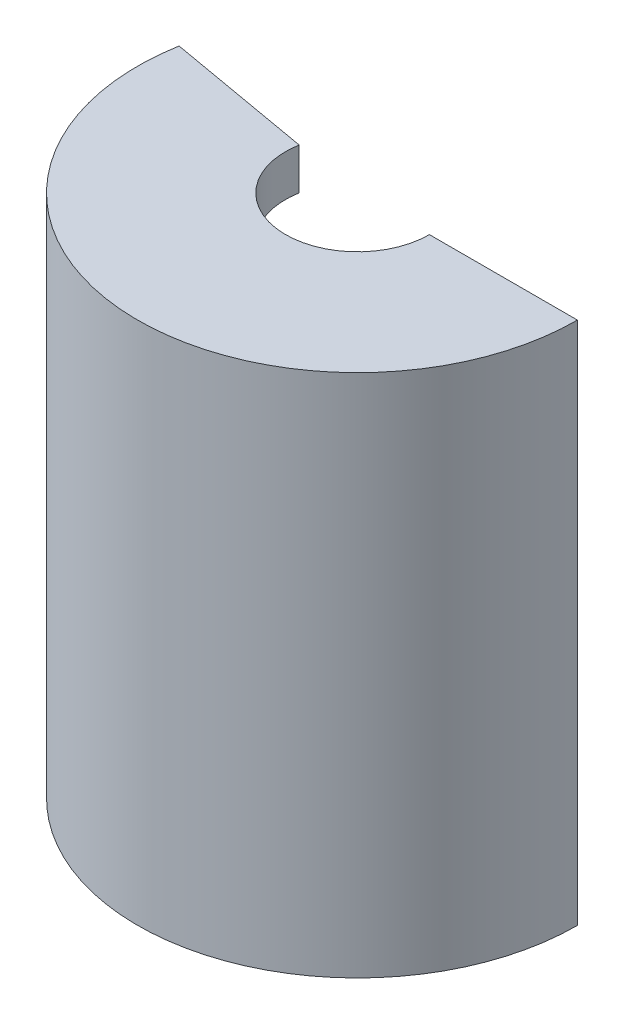
from build123d import *

# Parameters (mm, degrees)
REVOLVE1_ANGLE = 190


with BuildPart() as part:
    # Sketch1 → Revolve1 (revolve)
    with BuildSketch(Plane.XY):
        Polygon((5.2, 102.642966667), (5.2, 99.642966667), (12.897098368, 99.642966667), (12.897098368, 77.4), (9.725, 77.4), (9.725, 67.748), (2.7, 67.748), (2.7, 64.748), (15.897098368, 64.748), (15.897098368, 102.642966667), align=None)
    revolve(axis=Axis((0, 104.537715, 0), (0, -1, 0)), revolution_arc=REVOLVE1_ANGLE)


solid = part.part
